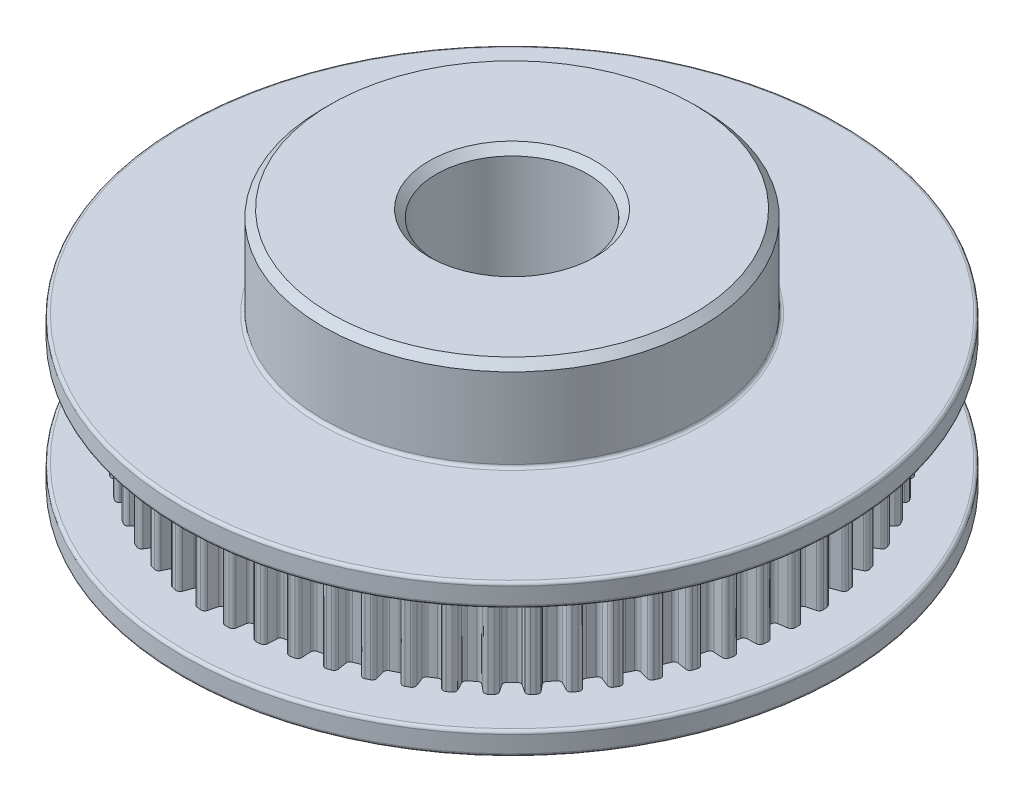
from build123d import *

# Parameters (mm, degrees)
SKETCH1_R           = 21.8
BOSS_EXTRUDE1_DEPTH = 1.5
BOSS_EXTRUDE2_DEPTH = 7
SKETCH3_R           = 21.8
BOSS_EXTRUDE3_DEPTH = 1.5
SKETCH4_R           = 12.5
BOSS_EXTRUDE4_DEPTH = 6
SKETCH5_R           = 5
CUT_EXTRUDE1_DEPTH  = 35.734420968
FILLET1_R           = 0.2
CHAMFER1_SIZE       = 0.5


with BuildPart() as part:
    # Sketch1 → Boss-Extrude1 (new body)
    with BuildSketch(Plane(origin=(0, 0, 0), x_dir=(1, 0, 0), z_dir=(0, 1, 0))):
        Circle(SKETCH1_R)
    extrude(amount=BOSS_EXTRUDE1_DEPTH)

    # Sketch2 → Boss-Extrude2 (add)
    with BuildSketch(Plane(origin=(0, 1.5, 0), x_dir=(1, 0, 0), z_dir=(0, 1, 0))):
        with BuildLine():
            Line((-0.381424745, 18.636465509), (-0.469235302, 18.048863862))
            ThreePointArc((-0.469235302, 18.048863862), (-0.54958138, 17.899690724), (-0.706593438, 17.836009243))
            ThreePointArc((-0.706593438, 17.836009243), (-0.934196819, 17.825537195), (-1.161647992, 17.812160844))
            ThreePointArc((-1.161647992, 17.812160844), (-1.324456449, 17.859081242), (-1.419955221, 17.999038743))
            Line((-1.419955221, 17.999038743), (-1.56870584, 18.574242744))
            ThreePointArc((-1.56870584, 18.574242744), (-1.667503146, 18.716546195), (-1.83508144, 18.76046311))
            ThreePointArc((-1.83508144, 18.76046311), (-1.970361533, 18.746737728), (-2.105539098, 18.732036865))
            ThreePointArc((-2.105539098, 18.732036865), (-2.260324564, 18.654238153), (-2.327376361, 18.494503259))
            Line((-2.327376361, 18.494503259), (-2.353284785, 17.900941853))
            ThreePointArc((-2.353284785, 17.900941853), (-2.41759788, 17.744187448), (-2.567093282, 17.664442592))
            ThreePointArc((-2.567093282, 17.664442592), (-2.792355201, 17.63023688), (-3.017162163, 17.593158684))
            ThreePointArc((-3.017162163, 17.593158684), (-3.183983255, 17.622803929), (-3.293588418, 17.752012388))
            Line((-3.293588418, 17.752012388), (-3.501649356, 18.308516688))
            ThreePointArc((-3.501649356, 18.308516688), (-3.614780201, 18.439713455), (-3.786031051, 18.465873087))
            ThreePointArc((-3.786031051, 18.465873087), (-3.919135372, 18.438082274), (-4.052035762, 18.409332041))
            ThreePointArc((-4.052035762, 18.409332041), (-4.197841117, 18.315780032), (-4.247828754, 18.14991136))
            Line((-4.247828754, 18.14991136), (-4.211551188, 17.556893378))
            ThreePointArc((-4.211551188, 17.556893378), (-4.259126672, 17.394275142), (-4.399467515, 17.299340611))
            ThreePointArc((-4.399467515, 17.299340611), (-4.619919955, 17.241775999), (-4.839619674, 17.181402196))
            ThreePointArc((-4.839619674, 17.181402196), (-5.008625675, 17.193447489), (-5.131136371, 17.310491271))
            Line((-5.131136371, 17.310491271), (-5.396228068, 17.842198691))
            ThreePointArc((-5.396228068, 17.842198691), (-5.522452967, 17.960851356), (-5.695500113, 17.968967095))
            ThreePointArc((-5.695500113, 17.968967095), (-5.824970344, 17.927415332), (-5.954137474, 17.884930722))
            ThreePointArc((-5.954137474, 17.884930722), (-6.089365245, 17.776650391), (-6.121741047, 17.606465235))
            Line((-6.121741047, 17.606465235), (-6.023674954, 17.020487905))
            ThreePointArc((-6.023674954, 17.020487905), (-6.05399158, 16.853787516), (-6.183640261, 16.744703435))
            ThreePointArc((-6.183640261, 16.744703435), (-6.396867899, 16.664410613), (-6.6090533, 16.581402669))
            ThreePointArc((-6.6090533, 16.581402669), (-6.778392544, 16.575716039), (-6.91246652, 16.679312789))
            Line((-6.91246652, 16.679312789), (-7.231684577, 17.180397833))
            ThreePointArc((-7.231684577, 17.180397833), (-7.369620583, 17.285206411), (-7.542568085, 17.275189339))
            ThreePointArc((-7.542568085, 17.275189339), (-7.666985722, 17.220331877), (-7.79100441, 17.16457836))
            ThreePointArc((-7.79100441, 17.16457836), (-7.914173012, 17.042756049), (-7.928582263, 16.870118992))
            Line((-7.928582263, 16.870118992), (-7.769802078, 16.297602405))
            ThreePointArc((-7.769802078, 16.297602405), (-7.78252769, 16.128646268), (-7.900063751, 16.006607783))
            ThreePointArc((-7.900063751, 16.006607783), (-8.10373042, 15.904466457), (-8.306076754, 15.799733825))
            ThreePointArc((-8.306076754, 15.799733825), (-8.473893926, 15.776377577), (-8.618062239, 15.865392265))
            Line((-8.618062239, 15.865392265), (-8.987909236, 16.33036494))
            ThreePointArc((-8.987909236, 16.33036494), (-9.136045094, 16.420181127), (-9.306998102, 16.392140993))
            ThreePointArc((-9.306998102, 16.392140993), (-9.425, 16.324578861), (-9.542511472, 16.256167286))
            ThreePointArc((-9.542511472, 16.256167286), (-9.652271444, 16.122137705), (-9.648556273, 15.948940195))
            Line((-9.648556273, 15.948940195), (-9.430801623, 15.396156963))
            ThreePointArc((-9.430801623, 15.396156963), (-9.425796798, 15.226796197), (-9.529932489, 15.093140388))
            ThreePointArc((-9.529932489, 15.093140388), (-9.721806775, 14.970269638), (-9.912097093, 14.844959792))
            ThreePointArc((-9.912097093, 14.844959792), (-10.076553552, 14.80418982), (-10.229236665, 14.877647184))
            Line((-10.229236665, 14.877647184), (-10.64566048, 15.301413152))
            ThreePointArc((-10.64566048, 15.301413152), (-10.802373183, 15.375252903), (-10.9694587, 15.32949692))
            ThreePointArc((-10.9694587, 15.32949692), (-11.079752006, 15.249970344), (-11.18946878, 15.16965024))
            ThreePointArc((-11.18946878, 15.16965024), (-11.28461757, 15.024881847), (-11.262818682, 14.853021472))
            Line((-11.262818682, 14.853021472), (-10.988475333, 14.326028003))
            ThreePointArc((-10.988475333, 14.326028003), (-10.965794904, 14.15811816), (-11.055389292, 14.014309387))
            ThreePointArc((-11.055389292, 14.014309387), (-11.23336898, 13.872055412), (-11.409518423, 13.727541272))
            ThreePointArc((-11.409518423, 13.727541272), (-11.568812349, 13.669804261), (-11.728337434, 13.726899487))
            Line((-11.728337434, 13.726899487), (-12.186775641, 14.104815879))
            ThreePointArc((-12.186775641, 14.104815879), (-12.350348211, 14.16187019), (-12.511735613, 14.098899671))
            ThreePointArc((-12.511735613, 14.098899671), (-12.61311193, 14.00827996), (-12.713831927, 13.916931333))
            ThreePointArc((-12.713831927, 13.916931333), (-12.793327064, 13.763010239), (-12.753683292, 13.594369937))
            Line((-12.753683292, 13.594369937), (-12.425757007, 13.098940083))
            ThreePointArc((-12.425757007, 13.098940083), (-12.385649466, 12.934320817), (-12.459720937, 12.78193468))
            ThreePointArc((-12.459720937, 12.78193468), (-12.621856044, 12.621856044), (-12.78193468, 12.459720937))
            ThreePointArc((-12.78193468, 12.459720937), (-12.934320817, 12.385649466), (-13.098940083, 12.425757007))
            Line((-13.098940083, 12.425757007), (-13.594369937, 12.753683292))
            ThreePointArc((-13.594369937, 12.753683292), (-13.763010239, 12.793327064), (-13.916931333, 12.713831927))
            ThreePointArc((-13.916931333, 12.713831927), (-14.00827996, 12.61311193), (-14.098899671, 12.511735613))
            ThreePointArc((-14.098899671, 12.511735613), (-14.16187019, 12.350348211), (-14.104815879, 12.186775641))
            Line((-14.104815879, 12.186775641), (-13.726899487, 11.728337434))
            ThreePointArc((-13.726899487, 11.728337434), (-13.669804261, 11.568812349), (-13.727541272, 11.409518423))
            ThreePointArc((-13.727541272, 11.409518423), (-13.872055412, 11.23336898), (-14.014309387, 11.055389292))
            ThreePointArc((-14.014309387, 11.055389292), (-14.15811816, 10.965794904), (-14.326028003, 10.988475333))
            Line((-14.326028003, 10.988475333), (-14.853021472, 11.262818682))
            ThreePointArc((-14.853021472, 11.262818682), (-15.024881847, 11.28461757), (-15.16965024, 11.18946878))
            ThreePointArc((-15.16965024, 11.18946878), (-15.249970344, 11.079752006), (-15.32949692, 10.9694587))
            ThreePointArc((-15.32949692, 10.9694587), (-15.375252903, 10.802373183), (-15.301413152, 10.64566048))
            Line((-15.301413152, 10.64566048), (-14.877647184, 10.229236665))
            ThreePointArc((-14.877647184, 10.229236665), (-14.80418982, 10.076553552), (-14.844959792, 9.912097093))
            ThreePointArc((-14.844959792, 9.912097093), (-14.970269638, 9.721806775), (-15.093140388, 9.529932489))
            ThreePointArc((-15.093140388, 9.529932489), (-15.226796197, 9.425796798), (-15.396156963, 9.430801623))
            Line((-15.396156963, 9.430801623), (-15.948940195, 9.648556273))
            ThreePointArc((-15.948940195, 9.648556273), (-16.122137705, 9.652271444), (-16.256167286, 9.542511472))
            ThreePointArc((-16.256167286, 9.542511472), (-16.324578861, 9.425), (-16.392140993, 9.306998102))
            ThreePointArc((-16.392140993, 9.306998102), (-16.420181127, 9.136045094), (-16.33036494, 8.987909236))
            Line((-16.33036494, 8.987909236), (-15.865392265, 8.618062239))
            ThreePointArc((-15.865392265, 8.618062239), (-15.776377577, 8.473893926), (-15.799733825, 8.306076754))
            ThreePointArc((-15.799733825, 8.306076754), (-15.904466457, 8.10373042), (-16.006607783, 7.900063751))
            ThreePointArc((-16.006607783, 7.900063751), (-16.128646268, 7.78252769), (-16.297602405, 7.769802078))
            Line((-16.297602405, 7.769802078), (-16.870118992, 7.928582263))
            ThreePointArc((-16.870118992, 7.928582263), (-17.042756049, 7.914173012), (-17.16457836, 7.79100441))
            ThreePointArc((-17.16457836, 7.79100441), (-17.220331877, 7.666985722), (-17.275189339, 7.542568085))
            ThreePointArc((-17.275189339, 7.542568085), (-17.285206411, 7.369620583), (-17.180397833, 7.231684577))
            Line((-17.180397833, 7.231684577), (-16.679312789, 6.91246652))
            ThreePointArc((-16.679312789, 6.91246652), (-16.575716039, 6.778392544), (-16.581402669, 6.6090533))
            ThreePointArc((-16.581402669, 6.6090533), (-16.664410613, 6.396867899), (-16.744703435, 6.183640261))
            ThreePointArc((-16.744703435, 6.183640261), (-16.853787516, 6.05399158), (-17.020487905, 6.023674954))
            Line((-17.020487905, 6.023674954), (-17.606465235, 6.121741047))
            ThreePointArc((-17.606465235, 6.121741047), (-17.776650391, 6.089365245), (-17.884930722, 5.954137474))
            ThreePointArc((-17.884930722, 5.954137474), (-17.927415332, 5.824970344), (-17.968967095, 5.695500113))
            ThreePointArc((-17.968967095, 5.695500113), (-17.960851356, 5.522452967), (-17.842198691, 5.396228068))
            Line((-17.842198691, 5.396228068), (-17.310491271, 5.131136371))
            ThreePointArc((-17.310491271, 5.131136371), (-17.193447489, 5.008625675), (-17.181402196, 4.839619674))
            ThreePointArc((-17.181402196, 4.839619674), (-17.241775999, 4.619919955), (-17.299340611, 4.399467515))
            ThreePointArc((-17.299340611, 4.399467515), (-17.394275142, 4.259126672), (-17.556893378, 4.211551188))
            Line((-17.556893378, 4.211551188), (-18.14991136, 4.247828754))
            ThreePointArc((-18.14991136, 4.247828754), (-18.315780032, 4.197841117), (-18.409332041, 4.052035762))
            ThreePointArc((-18.409332041, 4.052035762), (-18.438082274, 3.919135372), (-18.465873087, 3.786031051))
            ThreePointArc((-18.465873087, 3.786031051), (-18.439713455, 3.614780201), (-18.308516688, 3.501649356))
            Line((-18.308516688, 3.501649356), (-17.752012388, 3.293588418))
            ThreePointArc((-17.752012388, 3.293588418), (-17.622803929, 3.183983255), (-17.593158684, 3.017162163))
            ThreePointArc((-17.593158684, 3.017162163), (-17.63023688, 2.792355201), (-17.664442592, 2.567093282))
            ThreePointArc((-17.664442592, 2.567093282), (-17.744187448, 2.41759788), (-17.900941853, 2.353284785))
            Line((-17.900941853, 2.353284785), (-18.494503259, 2.327376361))
            ThreePointArc((-18.494503259, 2.327376361), (-18.654238153, 2.260324564), (-18.732036865, 2.105539098))
            ThreePointArc((-18.732036865, 2.105539098), (-18.746737728, 1.970361533), (-18.76046311, 1.83508144))
            ThreePointArc((-18.76046311, 1.83508144), (-18.716546195, 1.667503146), (-18.574242744, 1.56870584))
            Line((-18.574242744, 1.56870584), (-17.999038743, 1.419955221))
            ThreePointArc((-17.999038743, 1.419955221), (-17.859081242, 1.324456449), (-17.812160844, 1.161647992))
            ThreePointArc((-17.812160844, 1.161647992), (-17.825537195, 0.934196819), (-17.836009243, 0.706593438))
            ThreePointArc((-17.836009243, 0.706593438), (-17.899690724, 0.54958138), (-18.048863862, 0.469235302))
            Line((-18.048863862, 0.469235302), (-18.636465509, 0.381424745))
            ThreePointArc((-18.636465509, 0.381424745), (-18.788316538, 0.298043422), (-18.849509573, 0.135973707))
            ThreePointArc((-18.849509573, 0.135973707), (-18.85, 0), (-18.849509573, -0.135973707))
            ThreePointArc((-18.849509573, -0.135973707), (-18.788316538, -0.298043422), (-18.636465509, -0.381424745))
            Line((-18.636465509, -0.381424745), (-18.048863862, -0.469235302))
            ThreePointArc((-18.048863862, -0.469235302), (-17.899690724, -0.54958138), (-17.836009243, -0.706593438))
            ThreePointArc((-17.836009243, -0.706593438), (-17.825537195, -0.934196819), (-17.812160844, -1.161647992))
            ThreePointArc((-17.812160844, -1.161647992), (-17.859081242, -1.324456449), (-17.999038743, -1.419955221))
            Line((-17.999038743, -1.419955221), (-18.574242744, -1.56870584))
            ThreePointArc((-18.574242744, -1.56870584), (-18.716546195, -1.667503146), (-18.76046311, -1.83508144))
            ThreePointArc((-18.76046311, -1.83508144), (-18.746737728, -1.970361533), (-18.732036865, -2.105539098))
            ThreePointArc((-18.732036865, -2.105539098), (-18.654238153, -2.260324564), (-18.494503259, -2.327376361))
            Line((-18.494503259, -2.327376361), (-17.900941853, -2.353284785))
            ThreePointArc((-17.900941853, -2.353284785), (-17.744187448, -2.41759788), (-17.664442592, -2.567093282))
            ThreePointArc((-17.664442592, -2.567093282), (-17.63023688, -2.792355201), (-17.593158684, -3.017162163))
            ThreePointArc((-17.593158684, -3.017162163), (-17.622803929, -3.183983255), (-17.752012388, -3.293588418))
            Line((-17.752012388, -3.293588418), (-18.308516688, -3.501649356))
            ThreePointArc((-18.308516688, -3.501649356), (-18.439713455, -3.614780201), (-18.465873087, -3.786031051))
            ThreePointArc((-18.465873087, -3.786031051), (-18.438082274, -3.919135372), (-18.409332041, -4.052035762))
            ThreePointArc((-18.409332041, -4.052035762), (-18.315780032, -4.197841117), (-18.14991136, -4.247828754))
            Line((-18.14991136, -4.247828754), (-17.556893378, -4.211551188))
            ThreePointArc((-17.556893378, -4.211551188), (-17.394275142, -4.259126672), (-17.299340611, -4.399467515))
            ThreePointArc((-17.299340611, -4.399467515), (-17.241775999, -4.619919955), (-17.181402196, -4.839619674))
            ThreePointArc((-17.181402196, -4.839619674), (-17.193447489, -5.008625675), (-17.310491271, -5.131136371))
            Line((-17.310491271, -5.131136371), (-17.842198691, -5.396228068))
            ThreePointArc((-17.842198691, -5.396228068), (-17.960851356, -5.522452967), (-17.968967095, -5.695500113))
            ThreePointArc((-17.968967095, -5.695500113), (-17.927415332, -5.824970344), (-17.884930722, -5.954137474))
            ThreePointArc((-17.884930722, -5.954137474), (-17.776650391, -6.089365245), (-17.606465235, -6.121741047))
            Line((-17.606465235, -6.121741047), (-17.020487905, -6.023674954))
            ThreePointArc((-17.020487905, -6.023674954), (-16.853787516, -6.05399158), (-16.744703435, -6.183640261))
            ThreePointArc((-16.744703435, -6.183640261), (-16.664410613, -6.396867899), (-16.581402669, -6.6090533))
            ThreePointArc((-16.581402669, -6.6090533), (-16.575716039, -6.778392544), (-16.679312789, -6.91246652))
            Line((-16.679312789, -6.91246652), (-17.180397833, -7.231684577))
            ThreePointArc((-17.180397833, -7.231684577), (-17.285206411, -7.369620583), (-17.275189339, -7.542568085))
            ThreePointArc((-17.275189339, -7.542568085), (-17.220331877, -7.666985722), (-17.16457836, -7.79100441))
            ThreePointArc((-17.16457836, -7.79100441), (-17.042756049, -7.914173012), (-16.870118992, -7.928582263))
            Line((-16.870118992, -7.928582263), (-16.297602405, -7.769802078))
            ThreePointArc((-16.297602405, -7.769802078), (-16.128646268, -7.78252769), (-16.006607783, -7.900063751))
            ThreePointArc((-16.006607783, -7.900063751), (-15.904466457, -8.10373042), (-15.799733825, -8.306076754))
            ThreePointArc((-15.799733825, -8.306076754), (-15.776377577, -8.473893926), (-15.865392265, -8.618062239))
            Line((-15.865392265, -8.618062239), (-16.33036494, -8.987909236))
            ThreePointArc((-16.33036494, -8.987909236), (-16.420181127, -9.136045094), (-16.392140993, -9.306998102))
            ThreePointArc((-16.392140993, -9.306998102), (-16.324578861, -9.425), (-16.256167286, -9.542511472))
            ThreePointArc((-16.256167286, -9.542511472), (-16.122137705, -9.652271444), (-15.948940195, -9.648556273))
            Line((-15.948940195, -9.648556273), (-15.396156963, -9.430801623))
            ThreePointArc((-15.396156963, -9.430801623), (-15.226796197, -9.425796798), (-15.093140388, -9.529932489))
            ThreePointArc((-15.093140388, -9.529932489), (-14.970269638, -9.721806775), (-14.844959792, -9.912097093))
            ThreePointArc((-14.844959792, -9.912097093), (-14.80418982, -10.076553552), (-14.877647184, -10.229236665))
            Line((-14.877647184, -10.229236665), (-15.301413152, -10.64566048))
            ThreePointArc((-15.301413152, -10.64566048), (-15.375252903, -10.802373183), (-15.32949692, -10.9694587))
            ThreePointArc((-15.32949692, -10.9694587), (-15.249970344, -11.079752006), (-15.16965024, -11.18946878))
            ThreePointArc((-15.16965024, -11.18946878), (-15.024881847, -11.28461757), (-14.853021472, -11.262818682))
            Line((-14.853021472, -11.262818682), (-14.326028003, -10.988475333))
            ThreePointArc((-14.326028003, -10.988475333), (-14.15811816, -10.965794904), (-14.014309387, -11.055389292))
            ThreePointArc((-14.014309387, -11.055389292), (-13.872055412, -11.23336898), (-13.727541272, -11.409518423))
            ThreePointArc((-13.727541272, -11.409518423), (-13.669804261, -11.568812349), (-13.726899487, -11.728337434))
            Line((-13.726899487, -11.728337434), (-14.104815879, -12.186775641))
            ThreePointArc((-14.104815879, -12.186775641), (-14.16187019, -12.350348211), (-14.098899671, -12.511735613))
            ThreePointArc((-14.098899671, -12.511735613), (-14.00827996, -12.61311193), (-13.916931333, -12.713831927))
            ThreePointArc((-13.916931333, -12.713831927), (-13.763010239, -12.793327064), (-13.594369937, -12.753683292))
            Line((-13.594369937, -12.753683292), (-13.098940083, -12.425757007))
            ThreePointArc((-13.098940083, -12.425757007), (-12.934320817, -12.385649466), (-12.78193468, -12.459720937))
            ThreePointArc((-12.78193468, -12.459720937), (-12.621856044, -12.621856044), (-12.459720937, -12.78193468))
            ThreePointArc((-12.459720937, -12.78193468), (-12.385649466, -12.934320817), (-12.425757007, -13.098940083))
            Line((-12.425757007, -13.098940083), (-12.753683292, -13.594369937))
            ThreePointArc((-12.753683292, -13.594369937), (-12.793327064, -13.763010239), (-12.713831927, -13.916931333))
            ThreePointArc((-12.713831927, -13.916931333), (-12.61311193, -14.00827996), (-12.511735613, -14.098899671))
            ThreePointArc((-12.511735613, -14.098899671), (-12.350348211, -14.16187019), (-12.186775641, -14.104815879))
            Line((-12.186775641, -14.104815879), (-11.728337434, -13.726899487))
            ThreePointArc((-11.728337434, -13.726899487), (-11.568812349, -13.669804261), (-11.409518423, -13.727541272))
            ThreePointArc((-11.409518423, -13.727541272), (-11.23336898, -13.872055412), (-11.055389292, -14.014309387))
            ThreePointArc((-11.055389292, -14.014309387), (-10.965794904, -14.15811816), (-10.988475333, -14.326028003))
            Line((-10.988475333, -14.326028003), (-11.262818682, -14.853021472))
            ThreePointArc((-11.262818682, -14.853021472), (-11.28461757, -15.024881847), (-11.18946878, -15.16965024))
            ThreePointArc((-11.18946878, -15.16965024), (-11.079752006, -15.249970344), (-10.9694587, -15.32949692))
            ThreePointArc((-10.9694587, -15.32949692), (-10.802373183, -15.375252903), (-10.64566048, -15.301413152))
            Line((-10.64566048, -15.301413152), (-10.229236665, -14.877647184))
            ThreePointArc((-10.229236665, -14.877647184), (-10.076553552, -14.80418982), (-9.912097093, -14.844959792))
            ThreePointArc((-9.912097093, -14.844959792), (-9.721806775, -14.970269638), (-9.529932489, -15.093140388))
            ThreePointArc((-9.529932489, -15.093140388), (-9.425796798, -15.226796197), (-9.430801623, -15.396156963))
            Line((-9.430801623, -15.396156963), (-9.648556273, -15.948940195))
            ThreePointArc((-9.648556273, -15.948940195), (-9.652271444, -16.122137705), (-9.542511472, -16.256167286))
            ThreePointArc((-9.542511472, -16.256167286), (-9.425, -16.324578861), (-9.306998102, -16.392140993))
            ThreePointArc((-9.306998102, -16.392140993), (-9.136045094, -16.420181127), (-8.987909236, -16.33036494))
            Line((-8.987909236, -16.33036494), (-8.618062239, -15.865392265))
            ThreePointArc((-8.618062239, -15.865392265), (-8.473893926, -15.776377577), (-8.306076754, -15.799733825))
            ThreePointArc((-8.306076754, -15.799733825), (-8.10373042, -15.904466457), (-7.900063751, -16.006607783))
            ThreePointArc((-7.900063751, -16.006607783), (-7.78252769, -16.128646268), (-7.769802078, -16.297602405))
            Line((-7.769802078, -16.297602405), (-7.928582263, -16.870118992))
            ThreePointArc((-7.928582263, -16.870118992), (-7.914173012, -17.042756049), (-7.79100441, -17.16457836))
            ThreePointArc((-7.79100441, -17.16457836), (-7.666985722, -17.220331877), (-7.542568085, -17.275189339))
            ThreePointArc((-7.542568085, -17.275189339), (-7.369620583, -17.285206411), (-7.231684577, -17.180397833))
            Line((-7.231684577, -17.180397833), (-6.91246652, -16.679312789))
            ThreePointArc((-6.91246652, -16.679312789), (-6.778392544, -16.575716039), (-6.6090533, -16.581402669))
            ThreePointArc((-6.6090533, -16.581402669), (-6.396867899, -16.664410613), (-6.183640261, -16.744703435))
            ThreePointArc((-6.183640261, -16.744703435), (-6.05399158, -16.853787516), (-6.023674954, -17.020487905))
            Line((-6.023674954, -17.020487905), (-6.121741047, -17.606465235))
            ThreePointArc((-6.121741047, -17.606465235), (-6.089365245, -17.776650391), (-5.954137474, -17.884930722))
            ThreePointArc((-5.954137474, -17.884930722), (-5.824970344, -17.927415332), (-5.695500113, -17.968967095))
            ThreePointArc((-5.695500113, -17.968967095), (-5.522452967, -17.960851356), (-5.396228068, -17.842198691))
            Line((-5.396228068, -17.842198691), (-5.131136371, -17.310491271))
            ThreePointArc((-5.131136371, -17.310491271), (-5.008625675, -17.193447489), (-4.839619674, -17.181402196))
            ThreePointArc((-4.839619674, -17.181402196), (-4.619919955, -17.241775999), (-4.399467515, -17.299340611))
            ThreePointArc((-4.399467515, -17.299340611), (-4.259126672, -17.394275142), (-4.211551188, -17.556893378))
            Line((-4.211551188, -17.556893378), (-4.247828754, -18.14991136))
            ThreePointArc((-4.247828754, -18.14991136), (-4.197841117, -18.315780032), (-4.052035762, -18.409332041))
            ThreePointArc((-4.052035762, -18.409332041), (-3.919135372, -18.438082274), (-3.786031051, -18.465873087))
            ThreePointArc((-3.786031051, -18.465873087), (-3.614780201, -18.439713455), (-3.501649356, -18.308516688))
            Line((-3.501649356, -18.308516688), (-3.293588418, -17.752012388))
            ThreePointArc((-3.293588418, -17.752012388), (-3.183983255, -17.622803929), (-3.017162163, -17.593158684))
            ThreePointArc((-3.017162163, -17.593158684), (-2.792355201, -17.63023688), (-2.567093282, -17.664442592))
            ThreePointArc((-2.567093282, -17.664442592), (-2.41759788, -17.744187448), (-2.353284785, -17.900941853))
            Line((-2.353284785, -17.900941853), (-2.327376361, -18.494503259))
            ThreePointArc((-2.327376361, -18.494503259), (-2.260324564, -18.654238153), (-2.105539098, -18.732036865))
            ThreePointArc((-2.105539098, -18.732036865), (-1.970361533, -18.746737728), (-1.83508144, -18.76046311))
            ThreePointArc((-1.83508144, -18.76046311), (-1.667503146, -18.716546195), (-1.56870584, -18.574242744))
            Line((-1.56870584, -18.574242744), (-1.419955221, -17.999038743))
            ThreePointArc((-1.419955221, -17.999038743), (-1.324456449, -17.859081242), (-1.161647992, -17.812160844))
            ThreePointArc((-1.161647992, -17.812160844), (-0.934196819, -17.825537195), (-0.706593438, -17.836009243))
            ThreePointArc((-0.706593438, -17.836009243), (-0.54958138, -17.899690724), (-0.469235302, -18.048863862))
            Line((-0.469235302, -18.048863862), (-0.381424745, -18.636465509))
            ThreePointArc((-0.381424745, -18.636465509), (-0.298043422, -18.788316538), (-0.135973707, -18.849509573))
            ThreePointArc((-0.135973707, -18.849509573), (0, -18.85), (0.135973707, -18.849509573))
            ThreePointArc((0.135973707, -18.849509573), (0.298043422, -18.788316538), (0.381424745, -18.636465509))
            Line((0.381424745, -18.636465509), (0.469235302, -18.048863862))
            ThreePointArc((0.469235302, -18.048863862), (0.54958138, -17.899690724), (0.706593438, -17.836009243))
            ThreePointArc((0.706593438, -17.836009243), (0.934196819, -17.825537195), (1.161647992, -17.812160844))
            ThreePointArc((1.161647992, -17.812160844), (1.324456449, -17.859081242), (1.419955221, -17.999038743))
            Line((1.419955221, -17.999038743), (1.56870584, -18.574242744))
            ThreePointArc((1.56870584, -18.574242744), (1.667503146, -18.716546195), (1.83508144, -18.76046311))
            ThreePointArc((1.83508144, -18.76046311), (1.970361533, -18.746737728), (2.105539098, -18.732036865))
            ThreePointArc((2.105539098, -18.732036865), (2.260324564, -18.654238153), (2.327376361, -18.494503259))
            Line((2.327376361, -18.494503259), (2.353284785, -17.900941853))
            ThreePointArc((2.353284785, -17.900941853), (2.41759788, -17.744187448), (2.567093282, -17.664442592))
            ThreePointArc((2.567093282, -17.664442592), (2.792355201, -17.63023688), (3.017162163, -17.593158684))
            ThreePointArc((3.017162163, -17.593158684), (3.183983255, -17.622803929), (3.293588418, -17.752012388))
            Line((3.293588418, -17.752012388), (3.501649356, -18.308516688))
            ThreePointArc((3.501649356, -18.308516688), (3.614780201, -18.439713455), (3.786031051, -18.465873087))
            ThreePointArc((3.786031051, -18.465873087), (3.919135372, -18.438082274), (4.052035762, -18.409332041))
            ThreePointArc((4.052035762, -18.409332041), (4.197841117, -18.315780032), (4.247828754, -18.14991136))
            Line((4.247828754, -18.14991136), (4.211551188, -17.556893378))
            ThreePointArc((4.211551188, -17.556893378), (4.259126672, -17.394275142), (4.399467515, -17.299340611))
            ThreePointArc((4.399467515, -17.299340611), (4.619919955, -17.241775999), (4.839619674, -17.181402196))
            ThreePointArc((4.839619674, -17.181402196), (5.008625675, -17.193447489), (5.131136371, -17.310491271))
            Line((5.131136371, -17.310491271), (5.396228068, -17.842198691))
            ThreePointArc((5.396228068, -17.842198691), (5.522452967, -17.960851356), (5.695500113, -17.968967095))
            ThreePointArc((5.695500113, -17.968967095), (5.824970344, -17.927415332), (5.954137474, -17.884930722))
            ThreePointArc((5.954137474, -17.884930722), (6.089365245, -17.776650391), (6.121741047, -17.606465235))
            Line((6.121741047, -17.606465235), (6.023674954, -17.020487905))
            ThreePointArc((6.023674954, -17.020487905), (6.05399158, -16.853787516), (6.183640261, -16.744703435))
            ThreePointArc((6.183640261, -16.744703435), (6.396867899, -16.664410613), (6.6090533, -16.581402669))
            ThreePointArc((6.6090533, -16.581402669), (6.778392544, -16.575716039), (6.91246652, -16.679312789))
            Line((6.91246652, -16.679312789), (7.231684577, -17.180397833))
            ThreePointArc((7.231684577, -17.180397833), (7.369620583, -17.285206411), (7.542568085, -17.275189339))
            ThreePointArc((7.542568085, -17.275189339), (7.666985722, -17.220331877), (7.79100441, -17.16457836))
            ThreePointArc((7.79100441, -17.16457836), (7.914173012, -17.042756049), (7.928582263, -16.870118992))
            Line((7.928582263, -16.870118992), (7.769802078, -16.297602405))
            ThreePointArc((7.769802078, -16.297602405), (7.78252769, -16.128646268), (7.900063751, -16.006607783))
            ThreePointArc((7.900063751, -16.006607783), (8.10373042, -15.904466457), (8.306076754, -15.799733825))
            ThreePointArc((8.306076754, -15.799733825), (8.473893926, -15.776377577), (8.618062239, -15.865392265))
            Line((8.618062239, -15.865392265), (8.987909236, -16.33036494))
            ThreePointArc((8.987909236, -16.33036494), (9.136045094, -16.420181127), (9.306998102, -16.392140993))
            ThreePointArc((9.306998102, -16.392140993), (9.425, -16.324578861), (9.542511472, -16.256167286))
            ThreePointArc((9.542511472, -16.256167286), (9.652271444, -16.122137705), (9.648556273, -15.948940195))
            Line((9.648556273, -15.948940195), (9.430801623, -15.396156963))
            ThreePointArc((9.430801623, -15.396156963), (9.425796798, -15.226796197), (9.529932489, -15.093140388))
            ThreePointArc((9.529932489, -15.093140388), (9.721806775, -14.970269638), (9.912097093, -14.844959792))
            ThreePointArc((9.912097093, -14.844959792), (10.076553552, -14.80418982), (10.229236665, -14.877647184))
            Line((10.229236665, -14.877647184), (10.64566048, -15.301413152))
            ThreePointArc((10.64566048, -15.301413152), (10.802373183, -15.375252903), (10.9694587, -15.32949692))
            ThreePointArc((10.9694587, -15.32949692), (11.079752006, -15.249970344), (11.18946878, -15.16965024))
            ThreePointArc((11.18946878, -15.16965024), (11.28461757, -15.024881847), (11.262818682, -14.853021472))
            Line((11.262818682, -14.853021472), (10.988475333, -14.326028003))
            ThreePointArc((10.988475333, -14.326028003), (10.965794904, -14.15811816), (11.055389292, -14.014309387))
            ThreePointArc((11.055389292, -14.014309387), (11.23336898, -13.872055412), (11.409518423, -13.727541272))
            ThreePointArc((11.409518423, -13.727541272), (11.568812349, -13.669804261), (11.728337434, -13.726899487))
            Line((11.728337434, -13.726899487), (12.186775641, -14.104815879))
            ThreePointArc((12.186775641, -14.104815879), (12.350348211, -14.16187019), (12.511735613, -14.098899671))
            ThreePointArc((12.511735613, -14.098899671), (12.61311193, -14.00827996), (12.713831927, -13.916931333))
            ThreePointArc((12.713831927, -13.916931333), (12.793327064, -13.763010239), (12.753683292, -13.594369937))
            Line((12.753683292, -13.594369937), (12.425757007, -13.098940083))
            ThreePointArc((12.425757007, -13.098940083), (12.385649466, -12.934320817), (12.459720937, -12.78193468))
            ThreePointArc((12.459720937, -12.78193468), (12.621856044, -12.621856044), (12.78193468, -12.459720937))
            ThreePointArc((12.78193468, -12.459720937), (12.934320817, -12.385649466), (13.098940083, -12.425757007))
            Line((13.098940083, -12.425757007), (13.594369937, -12.753683292))
            ThreePointArc((13.594369937, -12.753683292), (13.763010239, -12.793327064), (13.916931333, -12.713831927))
            ThreePointArc((13.916931333, -12.713831927), (14.00827996, -12.61311193), (14.098899671, -12.511735613))
            ThreePointArc((14.098899671, -12.511735613), (14.16187019, -12.350348211), (14.104815879, -12.186775641))
            Line((14.104815879, -12.186775641), (13.726899487, -11.728337434))
            ThreePointArc((13.726899487, -11.728337434), (13.669804261, -11.568812349), (13.727541272, -11.409518423))
            ThreePointArc((13.727541272, -11.409518423), (13.872055412, -11.23336898), (14.014309387, -11.055389292))
            ThreePointArc((14.014309387, -11.055389292), (14.15811816, -10.965794904), (14.326028003, -10.988475333))
            Line((14.326028003, -10.988475333), (14.853021472, -11.262818682))
            ThreePointArc((14.853021472, -11.262818682), (15.024881847, -11.28461757), (15.16965024, -11.18946878))
            ThreePointArc((15.16965024, -11.18946878), (15.249970344, -11.079752006), (15.32949692, -10.9694587))
            ThreePointArc((15.32949692, -10.9694587), (15.375252903, -10.802373183), (15.301413152, -10.64566048))
            Line((15.301413152, -10.64566048), (14.877647184, -10.229236665))
            ThreePointArc((14.877647184, -10.229236665), (14.80418982, -10.076553552), (14.844959792, -9.912097093))
            ThreePointArc((14.844959792, -9.912097093), (14.970269638, -9.721806775), (15.093140388, -9.529932489))
            ThreePointArc((15.093140388, -9.529932489), (15.226796197, -9.425796798), (15.396156963, -9.430801623))
            Line((15.396156963, -9.430801623), (15.948940195, -9.648556273))
            ThreePointArc((15.948940195, -9.648556273), (16.122137705, -9.652271444), (16.256167286, -9.542511472))
            ThreePointArc((16.256167286, -9.542511472), (16.324578861, -9.425), (16.392140993, -9.306998102))
            ThreePointArc((16.392140993, -9.306998102), (16.420181127, -9.136045094), (16.33036494, -8.987909236))
            Line((16.33036494, -8.987909236), (15.865392265, -8.618062239))
            ThreePointArc((15.865392265, -8.618062239), (15.776377577, -8.473893926), (15.799733825, -8.306076754))
            ThreePointArc((15.799733825, -8.306076754), (15.904466457, -8.10373042), (16.006607783, -7.900063751))
            ThreePointArc((16.006607783, -7.900063751), (16.128646268, -7.78252769), (16.297602405, -7.769802078))
            Line((16.297602405, -7.769802078), (16.870118992, -7.928582263))
            ThreePointArc((16.870118992, -7.928582263), (17.042756049, -7.914173012), (17.16457836, -7.79100441))
            ThreePointArc((17.16457836, -7.79100441), (17.220331877, -7.666985722), (17.275189339, -7.542568085))
            ThreePointArc((17.275189339, -7.542568085), (17.285206411, -7.369620583), (17.180397833, -7.231684577))
            Line((17.180397833, -7.231684577), (16.679312789, -6.91246652))
            ThreePointArc((16.679312789, -6.91246652), (16.575716039, -6.778392544), (16.581402669, -6.6090533))
            ThreePointArc((16.581402669, -6.6090533), (16.664410613, -6.396867899), (16.744703435, -6.183640261))
            ThreePointArc((16.744703435, -6.183640261), (16.853787516, -6.05399158), (17.020487905, -6.023674954))
            Line((17.020487905, -6.023674954), (17.606465235, -6.121741047))
            ThreePointArc((17.606465235, -6.121741047), (17.776650391, -6.089365245), (17.884930722, -5.954137474))
            ThreePointArc((17.884930722, -5.954137474), (17.927415332, -5.824970344), (17.968967095, -5.695500113))
            ThreePointArc((17.968967095, -5.695500113), (17.960851356, -5.522452967), (17.842198691, -5.396228068))
            Line((17.842198691, -5.396228068), (17.310491271, -5.131136371))
            ThreePointArc((17.310491271, -5.131136371), (17.193447489, -5.008625675), (17.181402196, -4.839619674))
            ThreePointArc((17.181402196, -4.839619674), (17.241775999, -4.619919955), (17.299340611, -4.399467515))
            ThreePointArc((17.299340611, -4.399467515), (17.394275142, -4.259126672), (17.556893378, -4.211551188))
            Line((17.556893378, -4.211551188), (18.14991136, -4.247828754))
            ThreePointArc((18.14991136, -4.247828754), (18.315780032, -4.197841117), (18.409332041, -4.052035762))
            ThreePointArc((18.409332041, -4.052035762), (18.438082274, -3.919135372), (18.465873087, -3.786031051))
            ThreePointArc((18.465873087, -3.786031051), (18.439713455, -3.614780201), (18.308516688, -3.501649356))
            Line((18.308516688, -3.501649356), (17.752012388, -3.293588418))
            ThreePointArc((17.752012388, -3.293588418), (17.622803929, -3.183983255), (17.593158684, -3.017162163))
            ThreePointArc((17.593158684, -3.017162163), (17.63023688, -2.792355201), (17.664442592, -2.567093282))
            ThreePointArc((17.664442592, -2.567093282), (17.744187448, -2.41759788), (17.900941853, -2.353284785))
            Line((17.900941853, -2.353284785), (18.494503259, -2.327376361))
            ThreePointArc((18.494503259, -2.327376361), (18.654238153, -2.260324564), (18.732036865, -2.105539098))
            ThreePointArc((18.732036865, -2.105539098), (18.746737728, -1.970361533), (18.76046311, -1.83508144))
            ThreePointArc((18.76046311, -1.83508144), (18.716546195, -1.667503146), (18.574242744, -1.56870584))
            Line((18.574242744, -1.56870584), (17.999038743, -1.419955221))
            ThreePointArc((17.999038743, -1.419955221), (17.859081242, -1.324456449), (17.812160844, -1.161647992))
            ThreePointArc((17.812160844, -1.161647992), (17.825537195, -0.934196819), (17.836009243, -0.706593438))
            ThreePointArc((17.836009243, -0.706593438), (17.899690724, -0.54958138), (18.048863862, -0.469235302))
            Line((18.048863862, -0.469235302), (18.636465509, -0.381424745))
            ThreePointArc((18.636465509, -0.381424745), (18.788316538, -0.298043422), (18.849509573, -0.135973707))
            ThreePointArc((18.849509573, -0.135973707), (18.85, 0), (18.849509573, 0.135973707))
            ThreePointArc((18.849509573, 0.135973707), (18.788316538, 0.298043422), (18.636465509, 0.381424745))
            Line((18.636465509, 0.381424745), (18.048863862, 0.469235302))
            ThreePointArc((18.048863862, 0.469235302), (17.899690724, 0.54958138), (17.836009243, 0.706593438))
            ThreePointArc((17.836009243, 0.706593438), (17.825537195, 0.934196819), (17.812160844, 1.161647992))
            ThreePointArc((17.812160844, 1.161647992), (17.859081242, 1.324456449), (17.999038743, 1.419955221))
            Line((17.999038743, 1.419955221), (18.574242744, 1.56870584))
            ThreePointArc((18.574242744, 1.56870584), (18.716546195, 1.667503146), (18.76046311, 1.83508144))
            ThreePointArc((18.76046311, 1.83508144), (18.746737728, 1.970361533), (18.732036865, 2.105539098))
            ThreePointArc((18.732036865, 2.105539098), (18.654238153, 2.260324564), (18.494503259, 2.327376361))
            Line((18.494503259, 2.327376361), (17.900941853, 2.353284785))
            ThreePointArc((17.900941853, 2.353284785), (17.744187448, 2.41759788), (17.664442592, 2.567093282))
            ThreePointArc((17.664442592, 2.567093282), (17.63023688, 2.792355201), (17.593158684, 3.017162163))
            ThreePointArc((17.593158684, 3.017162163), (17.622803929, 3.183983255), (17.752012388, 3.293588418))
            Line((17.752012388, 3.293588418), (18.308516688, 3.501649356))
            ThreePointArc((18.308516688, 3.501649356), (18.439713455, 3.614780201), (18.465873087, 3.786031051))
            ThreePointArc((18.465873087, 3.786031051), (18.438082274, 3.919135372), (18.409332041, 4.052035762))
            ThreePointArc((18.409332041, 4.052035762), (18.315780032, 4.197841117), (18.14991136, 4.247828754))
            Line((18.14991136, 4.247828754), (17.556893378, 4.211551188))
            ThreePointArc((17.556893378, 4.211551188), (17.394275142, 4.259126672), (17.299340611, 4.399467515))
            ThreePointArc((17.299340611, 4.399467515), (17.241775999, 4.619919955), (17.181402196, 4.839619674))
            ThreePointArc((17.181402196, 4.839619674), (17.193447489, 5.008625675), (17.310491271, 5.131136371))
            Line((17.310491271, 5.131136371), (17.842198691, 5.396228068))
            ThreePointArc((17.842198691, 5.396228068), (17.960851356, 5.522452967), (17.968967095, 5.695500113))
            ThreePointArc((17.968967095, 5.695500113), (17.927415332, 5.824970344), (17.884930722, 5.954137474))
            ThreePointArc((17.884930722, 5.954137474), (17.776650391, 6.089365245), (17.606465235, 6.121741047))
            Line((17.606465235, 6.121741047), (17.020487905, 6.023674954))
            ThreePointArc((17.020487905, 6.023674954), (16.853787516, 6.05399158), (16.744703435, 6.183640261))
            ThreePointArc((16.744703435, 6.183640261), (16.664410613, 6.396867899), (16.581402669, 6.6090533))
            ThreePointArc((16.581402669, 6.6090533), (16.575716039, 6.778392544), (16.679312789, 6.91246652))
            Line((16.679312789, 6.91246652), (17.180397833, 7.231684577))
            ThreePointArc((17.180397833, 7.231684577), (17.285206411, 7.369620583), (17.275189339, 7.542568085))
            ThreePointArc((17.275189339, 7.542568085), (17.220331877, 7.666985722), (17.16457836, 7.79100441))
            ThreePointArc((17.16457836, 7.79100441), (17.042756049, 7.914173012), (16.870118992, 7.928582263))
            Line((16.870118992, 7.928582263), (16.297602405, 7.769802078))
            ThreePointArc((16.297602405, 7.769802078), (16.128646268, 7.78252769), (16.006607783, 7.900063751))
            ThreePointArc((16.006607783, 7.900063751), (15.904466457, 8.10373042), (15.799733825, 8.306076754))
            ThreePointArc((15.799733825, 8.306076754), (15.776377577, 8.473893926), (15.865392265, 8.618062239))
            Line((15.865392265, 8.618062239), (16.33036494, 8.987909236))
            ThreePointArc((16.33036494, 8.987909236), (16.420181127, 9.136045094), (16.392140993, 9.306998102))
            ThreePointArc((16.392140993, 9.306998102), (16.324578861, 9.425), (16.256167286, 9.542511472))
            ThreePointArc((16.256167286, 9.542511472), (16.122137705, 9.652271444), (15.948940195, 9.648556273))
            Line((15.948940195, 9.648556273), (15.396156963, 9.430801623))
            ThreePointArc((15.396156963, 9.430801623), (15.226796197, 9.425796798), (15.093140388, 9.529932489))
            ThreePointArc((15.093140388, 9.529932489), (14.970269638, 9.721806775), (14.844959792, 9.912097093))
            ThreePointArc((14.844959792, 9.912097093), (14.80418982, 10.076553552), (14.877647184, 10.229236665))
            Line((14.877647184, 10.229236665), (15.301413152, 10.64566048))
            ThreePointArc((15.301413152, 10.64566048), (15.375252903, 10.802373183), (15.32949692, 10.9694587))
            ThreePointArc((15.32949692, 10.9694587), (15.249970344, 11.079752006), (15.16965024, 11.18946878))
            ThreePointArc((15.16965024, 11.18946878), (15.024881847, 11.28461757), (14.853021472, 11.262818682))
            Line((14.853021472, 11.262818682), (14.326028003, 10.988475333))
            ThreePointArc((14.326028003, 10.988475333), (14.15811816, 10.965794904), (14.014309387, 11.055389292))
            ThreePointArc((14.014309387, 11.055389292), (13.872055412, 11.23336898), (13.727541272, 11.409518423))
            ThreePointArc((13.727541272, 11.409518423), (13.669804261, 11.568812349), (13.726899487, 11.728337434))
            Line((13.726899487, 11.728337434), (14.104815879, 12.186775641))
            ThreePointArc((14.104815879, 12.186775641), (14.16187019, 12.350348211), (14.098899671, 12.511735613))
            ThreePointArc((14.098899671, 12.511735613), (14.00827996, 12.61311193), (13.916931333, 12.713831927))
            ThreePointArc((13.916931333, 12.713831927), (13.763010239, 12.793327064), (13.594369937, 12.753683292))
            Line((13.594369937, 12.753683292), (13.098940083, 12.425757007))
            ThreePointArc((13.098940083, 12.425757007), (12.934320817, 12.385649466), (12.78193468, 12.459720937))
            ThreePointArc((12.78193468, 12.459720937), (12.621856044, 12.621856044), (12.459720937, 12.78193468))
            ThreePointArc((12.459720937, 12.78193468), (12.385649466, 12.934320817), (12.425757007, 13.098940083))
            Line((12.425757007, 13.098940083), (12.753683292, 13.594369937))
            ThreePointArc((12.753683292, 13.594369937), (12.793327064, 13.763010239), (12.713831927, 13.916931333))
            ThreePointArc((12.713831927, 13.916931333), (12.61311193, 14.00827996), (12.511735613, 14.098899671))
            ThreePointArc((12.511735613, 14.098899671), (12.350348211, 14.16187019), (12.186775641, 14.104815879))
            Line((12.186775641, 14.104815879), (11.728337434, 13.726899487))
            ThreePointArc((11.728337434, 13.726899487), (11.568812349, 13.669804261), (11.409518423, 13.727541272))
            ThreePointArc((11.409518423, 13.727541272), (11.23336898, 13.872055412), (11.055389292, 14.014309387))
            ThreePointArc((11.055389292, 14.014309387), (10.965794904, 14.15811816), (10.988475333, 14.326028003))
            Line((10.988475333, 14.326028003), (11.262818682, 14.853021472))
            ThreePointArc((11.262818682, 14.853021472), (11.28461757, 15.024881847), (11.18946878, 15.16965024))
            ThreePointArc((11.18946878, 15.16965024), (11.079752006, 15.249970344), (10.9694587, 15.32949692))
            ThreePointArc((10.9694587, 15.32949692), (10.802373183, 15.375252903), (10.64566048, 15.301413152))
            Line((10.64566048, 15.301413152), (10.229236665, 14.877647184))
            ThreePointArc((10.229236665, 14.877647184), (10.076553552, 14.80418982), (9.912097093, 14.844959792))
            ThreePointArc((9.912097093, 14.844959792), (9.721806775, 14.970269638), (9.529932489, 15.093140388))
            ThreePointArc((9.529932489, 15.093140388), (9.425796798, 15.226796197), (9.430801623, 15.396156963))
            Line((9.430801623, 15.396156963), (9.648556273, 15.948940195))
            ThreePointArc((9.648556273, 15.948940195), (9.652271444, 16.122137705), (9.542511472, 16.256167286))
            ThreePointArc((9.542511472, 16.256167286), (9.425, 16.324578861), (9.306998102, 16.392140993))
            ThreePointArc((9.306998102, 16.392140993), (9.136045094, 16.420181127), (8.987909236, 16.33036494))
            Line((8.987909236, 16.33036494), (8.618062239, 15.865392265))
            ThreePointArc((8.618062239, 15.865392265), (8.473893926, 15.776377577), (8.306076754, 15.799733825))
            ThreePointArc((8.306076754, 15.799733825), (8.10373042, 15.904466457), (7.900063751, 16.006607783))
            ThreePointArc((7.900063751, 16.006607783), (7.78252769, 16.128646268), (7.769802078, 16.297602405))
            Line((7.769802078, 16.297602405), (7.928582263, 16.870118992))
            ThreePointArc((7.928582263, 16.870118992), (7.914173012, 17.042756049), (7.79100441, 17.16457836))
            ThreePointArc((7.79100441, 17.16457836), (7.666985722, 17.220331877), (7.542568085, 17.275189339))
            ThreePointArc((7.542568085, 17.275189339), (7.369620583, 17.285206411), (7.231684577, 17.180397833))
            Line((7.231684577, 17.180397833), (6.91246652, 16.679312789))
            ThreePointArc((6.91246652, 16.679312789), (6.778392544, 16.575716039), (6.6090533, 16.581402669))
            ThreePointArc((6.6090533, 16.581402669), (6.396867899, 16.664410613), (6.183640261, 16.744703435))
            ThreePointArc((6.183640261, 16.744703435), (6.05399158, 16.853787516), (6.023674954, 17.020487905))
            Line((6.023674954, 17.020487905), (6.121741047, 17.606465235))
            ThreePointArc((6.121741047, 17.606465235), (6.089365245, 17.776650391), (5.954137474, 17.884930722))
            ThreePointArc((5.954137474, 17.884930722), (5.824970344, 17.927415332), (5.695500113, 17.968967095))
            ThreePointArc((5.695500113, 17.968967095), (5.522452967, 17.960851356), (5.396228068, 17.842198691))
            Line((5.396228068, 17.842198691), (5.131136371, 17.310491271))
            ThreePointArc((5.131136371, 17.310491271), (5.008625675, 17.193447489), (4.839619674, 17.181402196))
            ThreePointArc((4.839619674, 17.181402196), (4.619919955, 17.241775999), (4.399467515, 17.299340611))
            ThreePointArc((4.399467515, 17.299340611), (4.259126672, 17.394275142), (4.211551188, 17.556893378))
            Line((4.211551188, 17.556893378), (4.247828754, 18.14991136))
            ThreePointArc((4.247828754, 18.14991136), (4.197841117, 18.315780032), (4.052035762, 18.409332041))
            ThreePointArc((4.052035762, 18.409332041), (3.919135372, 18.438082274), (3.786031051, 18.465873087))
            ThreePointArc((3.786031051, 18.465873087), (3.614780201, 18.439713455), (3.501649356, 18.308516688))
            Line((3.501649356, 18.308516688), (3.293588418, 17.752012388))
            ThreePointArc((3.293588418, 17.752012388), (3.183983255, 17.622803929), (3.017162163, 17.593158684))
            ThreePointArc((3.017162163, 17.593158684), (2.792355201, 17.63023688), (2.567093282, 17.664442592))
            ThreePointArc((2.567093282, 17.664442592), (2.41759788, 17.744187448), (2.353284785, 17.900941853))
            Line((2.353284785, 17.900941853), (2.327376361, 18.494503259))
            ThreePointArc((2.327376361, 18.494503259), (2.260324564, 18.654238153), (2.105539098, 18.732036865))
            ThreePointArc((2.105539098, 18.732036865), (1.970361533, 18.746737728), (1.83508144, 18.76046311))
            ThreePointArc((1.83508144, 18.76046311), (1.667503146, 18.716546195), (1.56870584, 18.574242744))
            Line((1.56870584, 18.574242744), (1.419955221, 17.999038743))
            ThreePointArc((1.419955221, 17.999038743), (1.324456449, 17.859081242), (1.161647992, 17.812160844))
            ThreePointArc((1.161647992, 17.812160844), (0.934196819, 17.825537195), (0.706593438, 17.836009243))
            ThreePointArc((0.706593438, 17.836009243), (0.54958138, 17.899690724), (0.469235302, 18.048863862))
            Line((0.469235302, 18.048863862), (0.381424745, 18.636465509))
            ThreePointArc((0.381424745, 18.636465509), (0.298043422, 18.788316538), (0.135973707, 18.849509573))
            ThreePointArc((0.135973707, 18.849509573), (0, 18.85), (-0.135973707, 18.849509573))
            ThreePointArc((-0.135973707, 18.849509573), (-0.298043422, 18.788316538), (-0.381424745, 18.636465509))
        make_face()
    extrude(amount=BOSS_EXTRUDE2_DEPTH)

    # Sketch3 → Boss-Extrude3 (add)
    with BuildSketch(Plane(origin=(0, 8.5, 0), x_dir=(1, 0, 0), z_dir=(0, 1, 0))):
        Circle(SKETCH3_R)
    extrude(amount=BOSS_EXTRUDE3_DEPTH)

    # Sketch4 → Boss-Extrude4 (add)
    with BuildSketch(Plane(origin=(0, 10, 0), x_dir=(1, 0, 0), z_dir=(0, 1, 0))):
        Circle(SKETCH4_R)
    extrude(amount=BOSS_EXTRUDE4_DEPTH)

    # Sketch5 → Cut-Extrude1 (cut, through all)
    with BuildSketch(Plane(origin=(0, 16, 0), x_dir=(1, 0, 0), z_dir=(0, 1, 0))):
        Circle(SKETCH5_R)
    extrude(amount=-CUT_EXTRUDE1_DEPTH, mode=Mode.SUBTRACT)

    # Fillet1
    fillet1_edges = [part.edges().sort_by_distance(p)[0] for p in [
        (-21.8, 0, 0),
        (-21.8, 1.5, 0),
        (-21.8, 8.5, 0),
        (-21.8, 10, 0),
        (-12.5, 10, 0),
    ]]
    fillet(fillet1_edges, radius=FILLET1_R)

    # Chamfer1
    chamfer1_edges = [part.edges().sort_by_distance(p)[0] for p in [
        (-5, 0, 0),
        (-5, 16, 0),
        (-12.5, 16, 0),
    ]]
    chamfer(chamfer1_edges, length=CHAMFER1_SIZE)


solid = part.part
